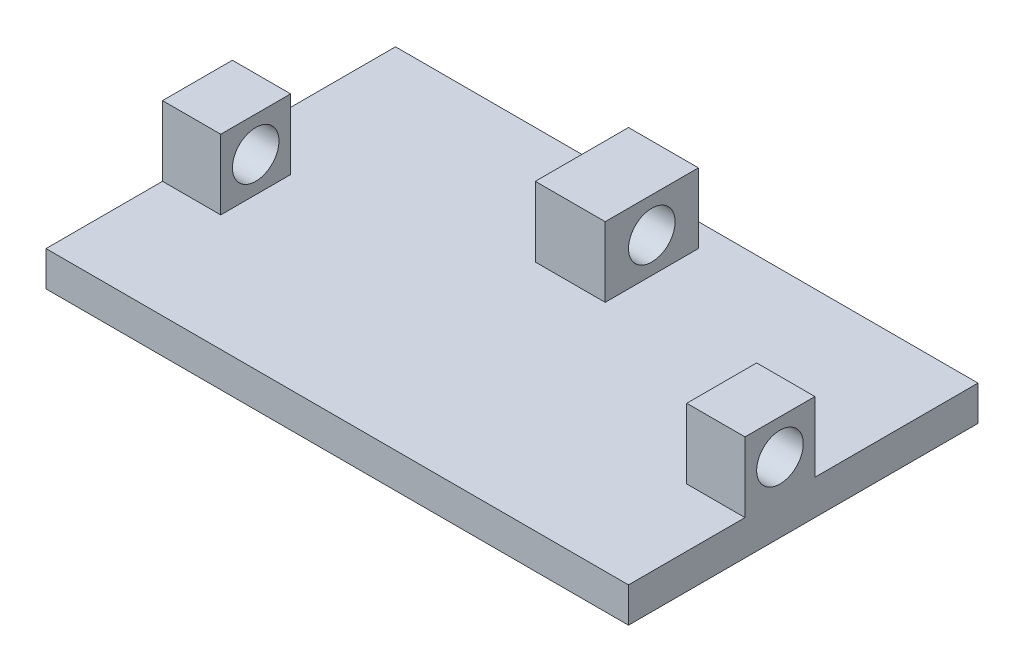
from build123d import *

# Parameters (mm, degrees)
SKETCH1_W                = 6
SKETCH1_H                = 8
BOSS_EXTRUDE1_DEPTH      = 3
SKETCH3_W                = 5
SKETCH3_H                = 6
BOSS_EXTRUDE3_DEPTH      = 6
SKETCH4_R                = 2
CUT_EXTRUDE1_DEPTH       = 53.971690553
BOSS_EXTRUDE4_DEPTH      = 6
BOSS_EXTRUDE4_DEPTH_BACK = 3
SKETCH5_W                = 6
SKETCH5_H                = 8
SKETCH6_R                = 2
CUT_EXTRUDE2_DEPTH       = 6


with BuildPart() as part:
    # Sketch1 → Boss-Extrude1 (new body)
    with BuildSketch(Plane(origin=(0, 0, 0), x_dir=(1, 0, 0), z_dir=(0, 1, 0))):
        Polygon((3, 15), (25, 15), (25, -15), (-25, -15), (-25, 15), (-3, 15), align=None)
        with Locations((0, 9)):
            Rectangle(SKETCH1_W, SKETCH1_H, mode=Mode.SUBTRACT)
    extrude(amount=BOSS_EXTRUDE1_DEPTH)

    # Sketch3 → Boss-Extrude3 (add)
    with BuildSketch(Plane(origin=(0, 3, 0), x_dir=(1, 0, 0), z_dir=(0, 1, 0))):
        with Locations((-22.5, -2)):
            Rectangle(SKETCH3_W, SKETCH3_H)
        with Locations((22.5, -2)):
            Rectangle(SKETCH3_W, SKETCH3_H)
    extrude(amount=BOSS_EXTRUDE3_DEPTH)

    # Sketch4 → Cut-Extrude1 (cut, through all)
    with BuildSketch(Plane.ZY.offset(25)):
        with Locations((2, 6)):
            Circle(SKETCH4_R)
    extrude(amount=-CUT_EXTRUDE1_DEPTH, mode=Mode.SUBTRACT)

    # Sketch5 → Boss-Extrude4 (add, two sides: drawn at the far end of the back side and taken through both)
    with BuildSketch(Plane(origin=(0, 3, 0), x_dir=(-1, 0, 0), z_dir=(0, 1, 0)).offset(-BOSS_EXTRUDE4_DEPTH_BACK)):
        with Locations((0, -9)):
            Rectangle(SKETCH5_W, SKETCH5_H)
    extrude(amount=BOSS_EXTRUDE4_DEPTH + BOSS_EXTRUDE4_DEPTH_BACK)

    # Sketch6 → Cut-Extrude2 (cut)
    with BuildSketch(Plane.ZY.offset(3)):
        with Locations((-9, 6)):
            Circle(SKETCH6_R)
    extrude(amount=-CUT_EXTRUDE2_DEPTH, mode=Mode.SUBTRACT)


solid = part.part
